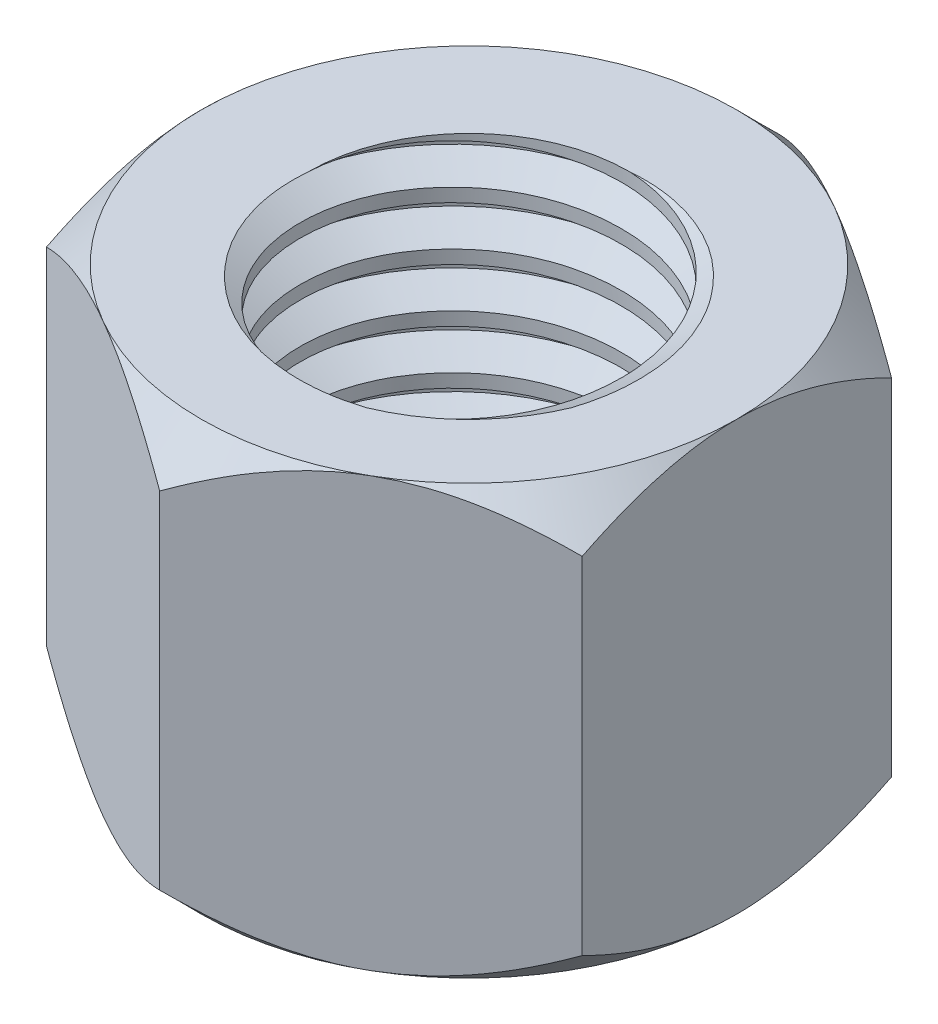
from build123d import *

# Parameters (mm, degrees)
SKETCH1_R                    = 3
BOSS_EXTRUDE1_DEPTH          = 4
SKETCH2_OUTSIDE_W            = 31.448
SKETCH2_OUTSIDE_H            = 32.996
SKETCH2_OUTSIDE_R            = 5
CUT_EXTRUDE1_DEPTH           = 4
CUT_EXTRUDE1_TAPER           = 45
CUT_EXTRUDE1_OTHER_WAY_DEPTH = 4
CUT_EXTRUDE1_OTHER_WAY_DRAFT = -45
MIRROR1_COPY_1_SKETCH_W      = 31.448
MIRROR1_COPY_1_SKETCH_H      = 32.996
MIRROR1_COPY_1_SKETCH_R      = 5
MIRROR1_COPY_1_DEPTH         = 4
MIRROR1_COPY_1_DRAFT         = -45
MIRROR1_COPY_2_SKETCH_W      = 31.448
MIRROR1_COPY_2_SKETCH_H      = 32.996
MIRROR1_COPY_2_SKETCH_R      = 5
MIRROR1_COPY_2_DEPTH         = 4
MIRROR1_COPY_2_DRAFT         = -45
THREAD1_PITCH                = 1


with BuildPart() as part:
    # Sketch1 → Boss-Extrude1 (new, symmetric)
    with BuildSketch(Plane(origin=(0, 0, 0), x_dir=(1, 0, 0), z_dir=(0, 1, 0))):
        Polygon((5, 2.886751346), (0, 5.773502692), (-5, 2.886751346), (-5, -2.886751346), (0, -5.773502692), (5, -2.886751346), align=None)
        with Locations(Location((0, 0, 0), (0, 0, 270))):
            Circle(SKETCH1_R, mode=Mode.SUBTRACT)
    extrude(amount=BOSS_EXTRUDE1_DEPTH, both=True)

    # Sketch2 outside → Cut-Extrude1 (cut)
    with BuildSketch(Plane(origin=(0, 4, 0), x_dir=(1, 0, 0), z_dir=(0, 1, 0))):
        Rectangle(SKETCH2_OUTSIDE_W, SKETCH2_OUTSIDE_H)
        Circle(SKETCH2_OUTSIDE_R, mode=Mode.SUBTRACT)
    cut_extrude1 = extrude(amount=CUT_EXTRUDE1_DEPTH, taper=CUT_EXTRUDE1_TAPER, mode=Mode.SUBTRACT)


with BuildPart() as cut_extrude1_other_way_tool:
    # Sketch2 outside → Cut-Extrude1 other way (with draft: the straight prism first)
    with BuildSketch(Plane(origin=(0, 4, 0), x_dir=(1, 0, 0), z_dir=(0, 1, 0))):
        Rectangle(SKETCH2_OUTSIDE_W, SKETCH2_OUTSIDE_H)
        Circle(SKETCH2_OUTSIDE_R, mode=Mode.SUBTRACT)
    extrude(amount=-CUT_EXTRUDE1_OTHER_WAY_DEPTH)
    # Cut-Extrude1 other way: the draft: its side faces are tilted about the plane it starts from
    cut_extrude1_other_way_sides = [cut_extrude1_other_way_tool.faces().sort_by_distance(p)[0] for p in [
        (0, 2, 16.498),
        (15.724, 2, 0),
        (0, 2, -16.498),
        (-15.724, 2, 0),
        (-5, 2, 0),
    ]]
    draft(cut_extrude1_other_way_sides, Plane(origin=(0, 4, 0), x_dir=(1, 0, 0), z_dir=(0, 1, 0)), CUT_EXTRUDE1_OTHER_WAY_DRAFT)


with BuildPart() as part_1:
    add(part.part)

    # Cut-Extrude1 other way: cut by cut_extrude1_other_way_tool
    add(cut_extrude1_other_way_tool.part, mode=Mode.SUBTRACT)

    # Mirror1: Cut-Extrude1 across plane
    add(cut_extrude1.mirror(Plane.ZX), mode=Mode.SUBTRACT)


with BuildPart() as mirror1_copy_1_tool:
    # Mirror1 copy 1 sketch → Mirror1 copy 1 (with draft: the straight prism first)
    with BuildSketch(Plane.XZ.offset(4)):
        Rectangle(MIRROR1_COPY_1_SKETCH_W, MIRROR1_COPY_1_SKETCH_H)
        Circle(MIRROR1_COPY_1_SKETCH_R, mode=Mode.SUBTRACT)
    extrude(amount=-MIRROR1_COPY_1_DEPTH)
    # Mirror1 copy 1: the draft: its side faces are tilted about the plane it starts from
    mirror1_copy_1_sides = [mirror1_copy_1_tool.faces().sort_by_distance(p)[0] for p in [
        (0, -2, 16.498),
        (15.724, -2, 0),
        (0, -2, -16.498),
        (-15.724, -2, 0),
        (-5, -2, 0),
    ]]
    draft(mirror1_copy_1_sides, Plane.XZ.offset(4), MIRROR1_COPY_1_DRAFT)


with BuildPart() as part_2:
    add(part_1.part)

    # Mirror1 copy 1: cut by mirror1_copy_1_tool
    add(mirror1_copy_1_tool.part, mode=Mode.SUBTRACT)


with BuildPart() as mirror1_copy_2_tool:
    # Mirror1 copy 2 sketch → Mirror1 copy 2 (with draft: the straight prism first)
    with BuildSketch(Plane.XZ.offset(4)):
        Rectangle(MIRROR1_COPY_2_SKETCH_W, MIRROR1_COPY_2_SKETCH_H)
        Circle(MIRROR1_COPY_2_SKETCH_R, mode=Mode.SUBTRACT)
    extrude(amount=-MIRROR1_COPY_2_DEPTH)
    # Mirror1 copy 2: the draft: its side faces are tilted about the plane it starts from
    mirror1_copy_2_sides = [mirror1_copy_2_tool.faces().sort_by_distance(p)[0] for p in [
        (0, -2, 16.498),
        (15.724, -2, 0),
        (0, -2, -16.498),
        (-15.724, -2, 0),
        (-5, -2, 0),
    ]]
    draft(mirror1_copy_2_sides, Plane.XZ.offset(4), MIRROR1_COPY_2_DRAFT)


with BuildPart() as part_3:
    add(part_2.part)

    # Mirror1 copy 2: cut by mirror1_copy_2_tool
    add(mirror1_copy_2_tool.part, mode=Mode.SUBTRACT)

    # Thread1: the profile of Thread Profile1 profile screwed along a right-hand helix of 30 turns, 8 arcs to a turn; built about Z, then put on its axis
    thread1_z = Axis((0, 0, 0), (0, 0, 1))
    thread1_corners = [(2.9997, 0, -0.000173205), (3.541265875, 0, 0.312499999), (3.541265875, 0, 0.437499999), (2.9997, 0, 0.750173202)]
    with BuildLine(mode=Mode.PRIVATE) as thread1_profile:
        Line(thread1_corners[0], thread1_corners[1])
        Line(thread1_corners[1], thread1_corners[2])
        Line(thread1_corners[2], thread1_corners[3])
        Line(thread1_corners[3], thread1_corners[0])
    thread1_cap = Face(thread1_profile.wire())
    thread1_turn_angles = [0, 22.5, 45, 67.5, 90, 112.5, 135, 157.5, 180, 202.5, 225, 247.5, 270, 292.5, 315, 337.5, 360]
    thread1_turn_weights = [1, 0.9238795325112867, 1, 0.9238795325112867, 1, 0.9238795325112867, 1, 0.9238795325112867, 1, 0.9238795325112867, 1, 0.9238795325112867, 1, 0.9238795325112867, 1, 0.9238795325112867, 1]
    thread1_turn_rails = [Edge.make_bspline([Vector(p[0], p[1], 0).rotate(thread1_z, thread1_turn_angles[k]) / thread1_turn_weights[k] + Vector(0, 0, p[2] + THREAD1_PITCH * thread1_turn_angles[k] / 360) for k in range(17)], [0, 0, 0, 1, 1, 2, 2, 3, 3, 4, 4, 5, 5, 6, 6, 7, 7, 8, 8, 8], 2, thread1_turn_weights) for p in thread1_corners]
    thread1_turn_sides = [Face.make_surface_from_curves(thread1_turn_rails[p[0]], thread1_turn_rails[p[1]]) for p in [(0, 1), (1, 2), (2, 3), (3, 0)]]
    thread1 = Plane(origin=(0, 7, 0), x_dir=(-1, 0, 0), z_dir=(0, -1, 0)) * Solid(Shell([*[p.moved(Location((0, 0, THREAD1_PITCH * i))) for i in range(30) for p in thread1_turn_sides], thread1_cap, thread1_cap.rotate(thread1_z, 10800).moved(Location((0, 0, THREAD1_PITCH * 10800 / 360)))]))
    add(thread1, mode=Mode.SUBTRACT)


solid = part_3.part
